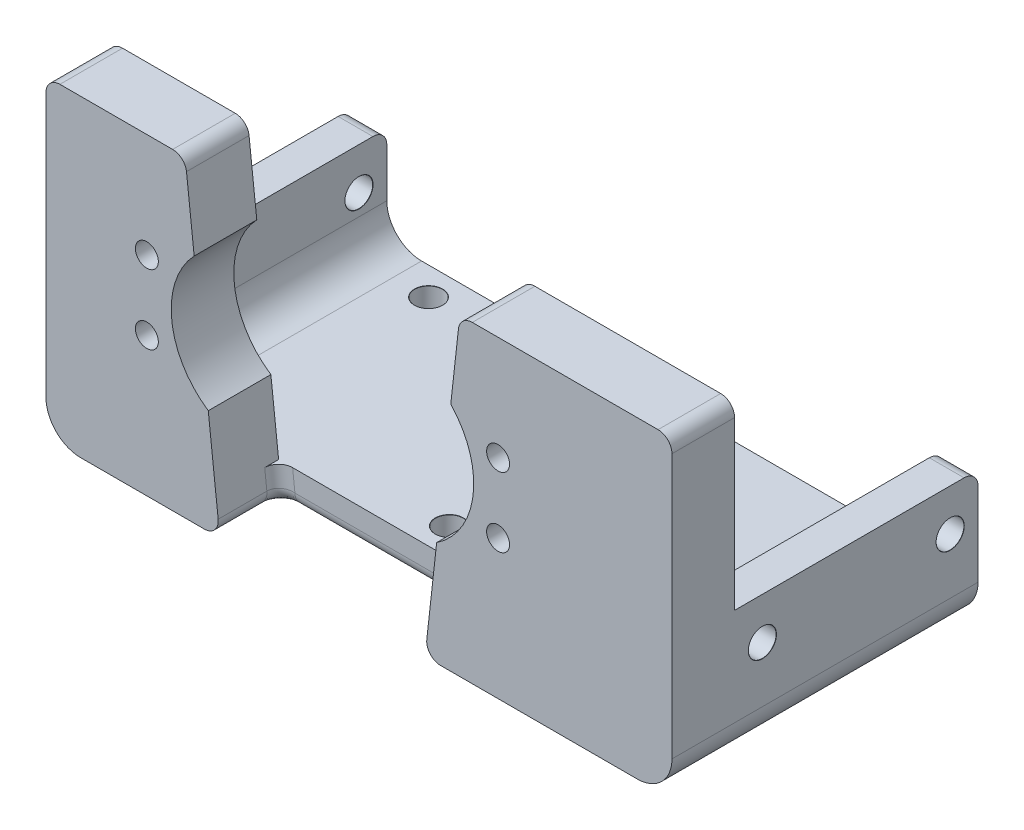
from build123d import *

# Parameters (mm, degrees)
BOSS_EXTRUDE1_DEPTH            = 35
SKETCH2_R                      = 1.65
BOSS_EXTRUDE2_DEPTH            = 9
BOSS_EXTRUDE3_DEPTH            = 10.5
SKETCH5_R                      = 19.5
CUT_EXTRUDE1_DEPTH             = 3
FILLET1_R                      = 5
FILLET2_R                      = 2
F_4_0MM_DOWEL_HOLE2_AT_2_COUNT = 2
F_4_0MM_DOWEL_HOLE2_AT_2_PITCH = 30
F_4_0MM_DOWEL_HOLE2_AT_3_COUNT = 2
F_4_0MM_DOWEL_HOLE2_AT_3_PITCH = 30


with BuildPart() as part:
    # Sketch1 → Boss-Extrude1 (new body)
    with BuildSketch(Plane.XY):
        Polygon((-45, 7), (-45, -12), (45, -12), (45, 7), (40, 7), (40, -7), (-40, -7), (-40, 7), align=None)
    extrude(amount=BOSS_EXTRUDE1_DEPTH)

    # Sketch2 → Boss-Extrude2 (add)
    with BuildSketch(Plane.XY.offset(35)):
        with BuildLine():
            Line((-45, 33), (-45, -12))
            Line((-45, -12), (-20, -12))
            Line((-20, -12), (-21.669336841, 3.024031571))
            ThreePointArc((-21.669336841, 3.024031571), (-26.926604816, 11.674821687), (-23.696516817, 21.268651356))
            Line((-23.696516817, 21.268651356), (-25, 33))
            Line((-25, 33), (-45, 33))
        make_face()
        with Locations((-30.5, 8)):
            Circle(SKETCH2_R, mode=Mode.SUBTRACT)
        with Locations((-30.5, 18)):
            Circle(SKETCH2_R, mode=Mode.SUBTRACT)
    boss_extrude2 = extrude(amount=BOSS_EXTRUDE2_DEPTH)

    # Mirror2: Boss-Extrude2 across plane
    add(boss_extrude2.mirror(Plane(origin=(-5.25, 13.784906966, -116.647939609), x_dir=(0, 0, 1), z_dir=(-1, 0, 0))))

    # Sketch4 → Boss-Extrude3 (add)
    with BuildSketch(Plane(origin=(34.5, 0, 0), x_dir=(0, 0, -1), z_dir=(1, 0, 0))):
        Polygon((-35, -7), (-35, 33), (-44, 33), (-44, -12), (-35, -12), align=None)
    extrude(amount=BOSS_EXTRUDE3_DEPTH)

    # Sketch5 → Cut-Extrude1 (cut)
    with BuildSketch(Plane(origin=(0, 0, 35), x_dir=(-1, 0, 0), z_dir=(0, 0, -1))):
        with Locations((-4.5, 13)):
            Circle(SKETCH5_R)
    extrude(amount=-CUT_EXTRUDE1_DEPTH, mode=Mode.SUBTRACT)

    # Fillet1
    fillet1_edges = [part.edges().sort_by_distance(p)[0] for p in [
        (45, -12, 22),
        (-45, -12, 22),
        (-40, -7, 17.5),
        (40, -7, 17.5),
    ]]
    fillet(fillet1_edges, radius=FILLET1_R)

    # Fillet2
    fillet2_edges = [part.edges().sort_by_distance(p)[0] for p in [
        (-5.25, -12, 35),
        (-45, 33, 39.5),
        (-25, 33, 39.5),
        (45, 33, 39.5),
        (-42.5, 7, 0),
        (42.5, 7, 0),
        (14.5, 33, 39.5),
        (9.777777778, -9.5, 35),
        (-20.277777778, -9.5, 35),
        (-20, -12, 39.5),
        (9.5, -12, 39.5),
    ]]
    fillet(fillet2_edges, radius=FILLET2_R)

    # Sketch6 → Ø4.0mm Dowel Hole2 (revolve, cut)
    with BuildSketch(Plane(origin=(0, -12, 4), x_dir=(0, 0, -1), z_dir=(1, 0, 0))):
        Polygon((0, 0), (0, 5), (2.025, 5), (2, 4.975), (2, 0.025), (2.025, 0), align=None)
    f_4_0mm_dowel_hole2 = revolve(axis=Axis((0, -18.35, 4), (0, 1, 0)), mode=Mode.SUBTRACT)

    # Ø4.0mm Dowel Hole2 at 2: Ø4.0mm Dowel Hole2 ×2
    with Locations(*[(i * F_4_0MM_DOWEL_HOLE2_AT_2_PITCH, 0, 0) for i in range(1, F_4_0MM_DOWEL_HOLE2_AT_2_COUNT)]):
        add(f_4_0mm_dowel_hole2, mode=Mode.SUBTRACT)

    # Ø4.0mm Dowel Hole2 at 3: Ø4.0mm Dowel Hole2 ×2
    with Locations(*[(-i * F_4_0MM_DOWEL_HOLE2_AT_3_PITCH, 0, 0) for i in range(1, F_4_0MM_DOWEL_HOLE2_AT_3_COUNT)]):
        add(f_4_0mm_dowel_hole2, mode=Mode.SUBTRACT)

    # Sketch9 → Ø4.0mm Dowel Hole3 (revolve, cut)
    with BuildSketch(Plane(origin=(45, 1, 4), x_dir=(0, 0, -1), z_dir=(0, 1, 0))):
        Polygon((0, 0), (0, 5), (2.025, 5), (2, 4.975), (2, 0.025), (2.025, 0), align=None)
    f_4_0mm_dowel_hole3 = revolve(axis=Axis((51.35, 1, 4), (-1, 0, 0)), mode=Mode.SUBTRACT)

    # Mirror3: Ø4.0mm Dowel Hole3 across plane
    add(f_4_0mm_dowel_hole3.mirror(Plane(origin=(0, 0, 0), x_dir=(0, 0, 1), z_dir=(1, 0, 0))), mode=Mode.SUBTRACT)

    # Mirror4: Ø4.0mm Dowel Hole2, Ø4.0mm Dowel Hole3 across plane
    add(f_4_0mm_dowel_hole2.mirror(Plane(origin=(0, 0, 17.5), x_dir=(1, 0, 0), z_dir=(0, 0, -1))), mode=Mode.SUBTRACT)
    add(f_4_0mm_dowel_hole3.mirror(Plane(origin=(0, 0, 17.5), x_dir=(1, 0, 0), z_dir=(0, 0, -1))), mode=Mode.SUBTRACT)

    # Mirror4 copy 1 sketch → Mirror4 copy 1 (revolve, cut)
    with BuildSketch(Plane(origin=(30, -12, 31), x_dir=(0, 0, 1), z_dir=(1, 0, 0))):
        Polygon((0, 0), (0, -5), (2.025, -5), (2, -4.975), (2, -0.025), (2.025, 0), align=None)
    revolve(axis=Axis((30, -18.35, 31), (0, -1, 0)), mode=Mode.SUBTRACT)

    # Mirror4 copy 2 sketch → Mirror4 copy 2 (revolve, cut)
    with BuildSketch(Plane(origin=(-30, -12, 31), x_dir=(0, 0, 1), z_dir=(1, 0, 0))):
        Polygon((0, 0), (0, -5), (2.025, -5), (2, -4.975), (2, -0.025), (2.025, 0), align=None)
    revolve(axis=Axis((-30, -18.35, 31), (0, -1, 0)), mode=Mode.SUBTRACT)

    # Mirror4 copy 3 sketch → Mirror4 copy 3 (revolve, cut)
    with BuildSketch(Plane(origin=(-45, 1, 31), x_dir=(0, 0, 1), z_dir=(0, 1, 0))):
        Polygon((0, 0), (0, 5), (2.025, 5), (2, 4.975), (2, 0.025), (2.025, 0), align=None)
    revolve(axis=Axis((-51.35, 1, 31), (1, 0, 0)), mode=Mode.SUBTRACT)


solid = part.part
